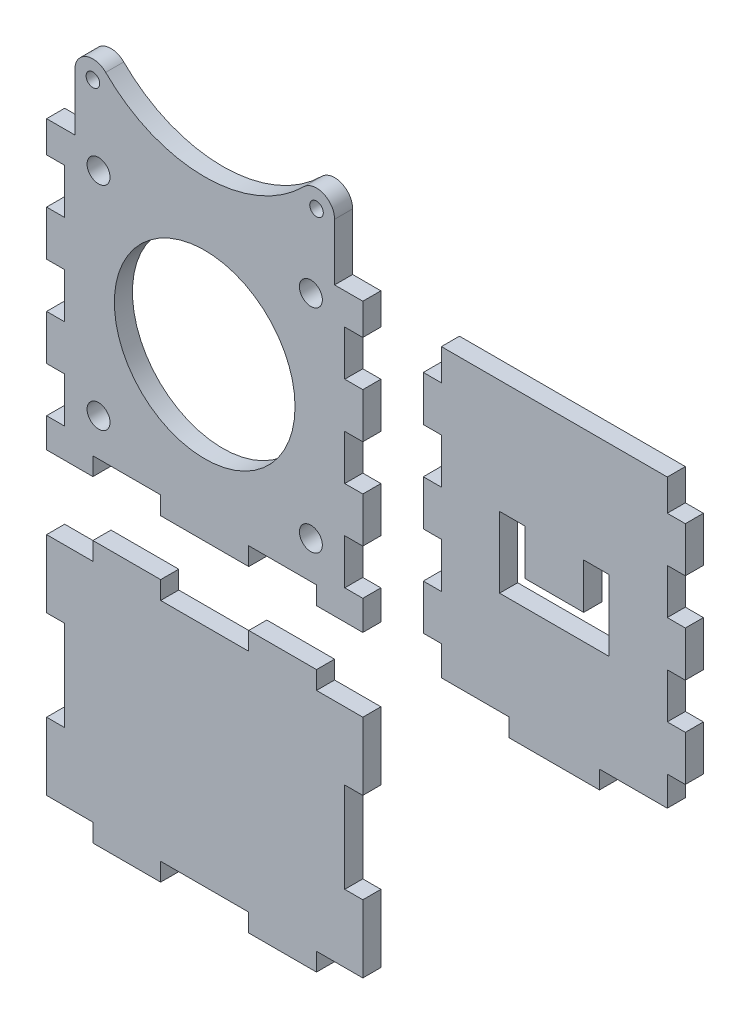
from build123d import *

# Parameters (mm, degrees)
SKETCH1_R             = 2.54
SKETCH1_R_2           = 20
SKETCH1_R_3           = 1.5
BOSS_EXTRUDE1_DEPTH   = 4
BOSS_EXTRUDE1_2_DEPTH = 4
BOSS_EXTRUDE1_3_DEPTH = 4


with BuildPart() as part:
    # Sketch1 → Boss-Extrude1 (new body)
    with BuildSketch(Plane.XY):
        with BuildLine():
            Line((-35, -94.278824944), (-35, -100.830704015))
            Line((-35, -100.830704015), (-24.748737342, -100.830704015))
            Line((-24.748737342, -100.830704015), (-24.748737342, -96.830704015))
            Line((-24.748737342, -96.830704015), (-9.748737342, -96.830704015))
            Line((-9.748737342, -96.830704015), (-9.748737342, -100.830704015))
            Line((-9.748737342, -100.830704015), (9.748737342, -100.830704015))
            Line((9.748737342, -100.830704015), (9.748737342, -96.830704015))
            Line((9.748737342, -96.830704015), (24.748737342, -96.830704015))
            Line((24.748737342, -96.830704015), (24.748737342, -100.830704015))
            Line((24.748737342, -100.830704015), (35, -100.830704015))
            Line((35, -100.830704015), (35, -94.278824944))
            Line((35, -94.278824944), (31, -94.278824944))
            Line((31, -94.278824944), (31, -84.278824944))
            Line((31, -84.278824944), (35, -84.278824944))
            Line((35, -84.278824944), (35, -74.278824944))
            Line((35, -74.278824944), (31, -74.278824944))
            Line((31, -74.278824944), (31, -64.278824944))
            Line((31, -64.278824944), (35, -64.278824944))
            Line((35, -64.278824944), (35, -54.278824944))
            Line((35, -54.278824944), (31, -54.278824944))
            Line((31, -54.278824944), (31, -44.278824944))
            Line((31, -44.278824944), (35, -44.278824944))
            Line((35, -44.278824944), (35, -37.330704015))
            Line((35, -37.330704015), (28.748737342, -37.330704015))
            Line((28.748737342, -37.330704015), (28.748737342, -24.748737342))
            ThreePointArc((28.748737342, -24.748737342), (26.279471071, -21.053219211), (21.920310217, -21.920310217))
            ThreePointArc((21.920310217, -21.920310217), (0, -31), (-21.920310217, -21.920310217))
            ThreePointArc((-21.920310217, -21.920310217), (-26.279471071, -21.053219211), (-28.748737342, -24.748737342))
            Line((-28.748737342, -24.748737342), (-28.748737342, -37.330704015))
            Line((-28.748737342, -37.330704015), (-35, -37.330704015))
            Line((-35, -37.330704015), (-35, -44.278824944))
            Line((-35, -44.278824944), (-31, -44.278824944))
            Line((-31, -44.278824944), (-31, -54.278824944))
            Line((-31, -54.278824944), (-35, -54.278824944))
            Line((-35, -54.278824944), (-35, -64.278824944))
            Line((-35, -64.278824944), (-31, -64.278824944))
            Line((-31, -64.278824944), (-31, -74.278824944))
            Line((-31, -74.278824944), (-35, -74.278824944))
            Line((-35, -74.278824944), (-35, -84.278824944))
            Line((-35, -84.278824944), (-31, -84.278824944))
            Line((-31, -84.278824944), (-31, -94.278824944))
            Line((-31, -94.278824944), (-35, -94.278824944))
        make_face()
        with Locations((-23.5, -88.549683874)):
            Circle(SKETCH1_R, mode=Mode.SUBTRACT)
        with Locations((0, -65.049683874)):
            Circle(SKETCH1_R_2, mode=Mode.SUBTRACT)
        with Locations((23.5, -88.549683874)):
            Circle(SKETCH1_R, mode=Mode.SUBTRACT)
        with Locations((-23.5, -41.549683874)):
            Circle(SKETCH1_R, mode=Mode.SUBTRACT)
        with Locations((-24.748737342, -24.748737342)):
            Circle(SKETCH1_R_3, mode=Mode.SUBTRACT)
        with Locations((23.5, -41.549683874)):
            Circle(SKETCH1_R, mode=Mode.SUBTRACT)
        with Locations((24.748737342, -24.748737342)):
            Circle(SKETCH1_R_3, mode=Mode.SUBTRACT)
    extrude(amount=BOSS_EXTRUDE1_DEPTH)


with BuildPart() as body_2:
    # Sketch1 → Boss-Extrude1 2 (new body)
    with BuildSketch(Plane.XY):
        Polygon((87.392932462, -104.830704015), (87.392932462, -100.830704015), (102.392932462, -100.830704015), (102.392932462, -94.278824944), (106.392932462, -94.278824944), (106.392932462, -84.278824944), (102.392932462, -84.278824944), (102.392932462, -74.278824944), (106.392932462, -74.278824944), (106.392932462, -64.278824944), (102.392932462, -64.278824944), (102.392932462, -54.278824944), (106.392932462, -54.278824944), (106.392932462, -44.278824944), (102.392932462, -44.278824944), (102.392932462, -37.330704015), (52.392932462, -37.330704015), (52.392932462, -44.278824944), (48.392932462, -44.278824944), (48.392932462, -54.278824944), (52.392932462, -54.278824944), (52.392932462, -64.278824944), (48.392932462, -64.278824944), (48.392932462, -74.278824944), (52.392932462, -74.278824944), (52.392932462, -84.278824944), (48.392932462, -84.278824944), (48.392932462, -94.278824944), (52.392932462, -94.278824944), (52.392932462, -100.830704015), (67.392932462, -100.830704015), (67.392932462, -104.830704015), align=None)
        Polygon((65.27265077, -78.159810059), (65.27265077, -62.481717659), (70.893098989, -62.481717659), (70.893098989, -72.53936184), (83.892765935, -72.53936184), (83.892765935, -62.481717659), (89.513214154, -62.481717659), (89.513214154, -78.159810059), align=None, mode=Mode.SUBTRACT)
    extrude(amount=BOSS_EXTRUDE1_2_DEPTH)


with BuildPart() as body_3:
    # Sketch1 → Boss-Extrude1 3 (new body)
    with BuildSketch(Plane.XY):
        Polygon((-24.748737342, -117.070270322), (-35, -117.070270322), (-35, -132.070270322), (-31, -132.070270322), (-31, -152.070270322), (-35, -152.070270322), (-35, -167.070270322), (-24.748737342, -167.070270322), (-24.748737342, -171.070270322), (-9.748737342, -171.070270322), (-9.748737342, -167.070270322), (9.748737342, -167.070270322), (9.748737342, -171.070270322), (24.748737342, -171.070270322), (24.748737342, -167.070270322), (35, -167.070270322), (35, -152.070270322), (31, -152.070270322), (31, -132.070270322), (35, -132.070270322), (35, -117.070270322), (24.748737342, -117.070270322), (24.748737342, -113.070270322), (9.748737342, -113.070270322), (9.748737342, -117.070270322), (-9.748737342, -117.070270322), (-9.748737342, -113.070270322), (-24.748737342, -113.070270322), align=None)
    extrude(amount=BOSS_EXTRUDE1_3_DEPTH)


solid = Compound([part.part, body_2.part, body_3.part])
